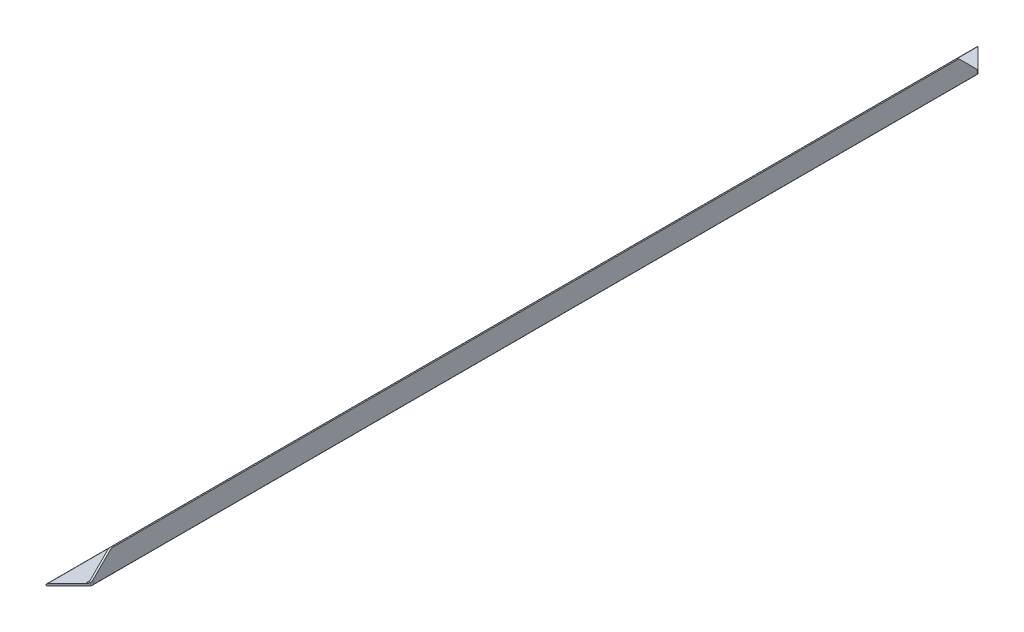
from build123d import *

# Parameters (mm, degrees)
BOSS_EXTRUDE1_DEPTH = 706
FILLET1_R           = 1.5
CUT_EXTRUDE1_DEPTH  = 708.733000502
CUT_EXTRUDE2_DEPTH  = 10
FILLET2_R           = 4
FILLET3_R           = 4
FILLET4_R           = 4
FILLET5_R           = 4
CUT_EXTRUDE3_DEPTH  = 10


with BuildPart() as part:
    # Sketch1 → Boss-Extrude1 (new, symmetric)
    with BuildSketch(Plane.XY):
        with BuildLine():
            Line((-1, 0), (-35, 0))
            Line((-35, 0), (-35, 3))
            Line((-35, 3), (-6, 3))
            ThreePointArc((-6, 3), (-3.878679656, 3.878679656), (-3, 6))
            Line((-3, 6), (-3, 35))
            Line((-3, 35), (0, 35))
            Line((0, 35), (0, 1))
            ThreePointArc((0, 1), (-0.292893219, 0.292893219), (-1, 0))
        make_face()
    extrude(amount=BOSS_EXTRUDE1_DEPTH, both=True)

    # Fillet1
    fillet1_edges = [part.edges().sort_by_distance(p)[0] for p in [
        (-35, 3, 0),
        (-3, 35, 0),
    ]]
    fillet(fillet1_edges, radius=FILLET1_R)

    # Sketch2 → Cut-Extrude1 (cut, through all)
    with BuildSketch(Plane.XZ):
        Polygon((-35, -706), (0, -671), (0, -706), align=None)
    cut_extrude1 = extrude(amount=-CUT_EXTRUDE1_DEPTH, mode=Mode.SUBTRACT)

    # Sketch3 → Cut-Extrude2 (cut)
    with BuildSketch(Plane(origin=(0, 0, 0), x_dir=(0, 0, -1), z_dir=(1, 0, 0))):
        Polygon((642, 35), (674, 3), (706, 3), (674, 35), align=None)
    cut_extrude2 = extrude(amount=-CUT_EXTRUDE2_DEPTH, mode=Mode.SUBTRACT)

    # Mirror1: Cut-Extrude1, Cut-Extrude2 across plane
    add(cut_extrude1.mirror(Plane.XY), mode=Mode.SUBTRACT)
    add(cut_extrude2.mirror(Plane.XY), mode=Mode.SUBTRACT)

    # Fillet2
    # the kernel refuses this fillet: 4 mm, written as the material it takes off along each edge
    with BuildSketch(Plane(origin=(4.142135624, 35, -642), x_dir=(0, 0, 1), z_dir=(-1, 0, 0))) as fillet2_piece_1:
        with BuildLine():
            CenterArc((FILLET2_R * 0.414213562373, -FILLET2_R), FILLET2_R, 90, 45)
            Line((-FILLET2_R * 0.292893218813, -FILLET2_R * 0.292893218813), (0, 0))
            Line((0, 0), (FILLET2_R * 0.414213562373, 0))
        make_face()
    extrude(amount=9.784271247, mode=Mode.SUBTRACT)

    # Fillet3
    # the kernel refuses this fillet: 4 mm, written as the material it takes off along each edge
    with BuildSketch(Plane(origin=(0, -3.142135624, -671), x_dir=(-0.707106781186569, 0, -0.707106781186526), z_dir=(0, 1, 0))) as fillet3_piece_1:
        with BuildLine():
            CenterArc((FILLET3_R * 0.414213562373, FILLET3_R), FILLET3_R, 225, 45)
            Line((-FILLET3_R * 0.292893218813, FILLET3_R * 0.292893218813), (0, 0))
            Line((0, 0), (FILLET3_R * 0.414213562373, 0))
        make_face()
    extrude(amount=13.284271247, mode=Mode.SUBTRACT)

    # Fillet4
    # the kernel refuses this fillet: 4 mm, written as the material it takes off along each edge
    with BuildSketch(Plane(origin=(0, -3.142135624, 671), x_dir=(-0.707106781186569, 0, 0.707106781186526), z_dir=(0, 1, 0))) as fillet4_piece_1:
        with BuildLine():
            CenterArc((FILLET4_R * 0.414213562373, -FILLET4_R), FILLET4_R, 90, 45)
            Line((-FILLET4_R * 0.292893218813, -FILLET4_R * 0.292893218813), (0, 0))
            Line((0, 0), (FILLET4_R * 0.414213562373, 0))
        make_face()
    extrude(amount=13.284271247, mode=Mode.SUBTRACT)

    # Fillet5
    # the kernel refuses this fillet: 4 mm, written as the material it takes off along each edge
    with BuildSketch(Plane(origin=(4.142135624, 35, 642), x_dir=(0, -0.7071067811865432, 0.7071067811865518), z_dir=(-1, 0, 0))) as fillet5_piece_1:
        with BuildLine():
            CenterArc((FILLET5_R * 0.414213562373, -FILLET5_R), FILLET5_R, 90, 45)
            Line((-FILLET5_R * 0.292893218813, -FILLET5_R * 0.292893218813), (0, 0))
            Line((0, 0), (FILLET5_R * 0.414213562373, 0))
        make_face()
    extrude(amount=9.784271247, mode=Mode.SUBTRACT)

    # Sketch4 → Cut-Extrude3 (cut)
    with BuildSketch(Plane.ZY.offset(35)):
        Polygon((711.147996861, -1.5), (711.147996861, 1.5), (706, 1.5), (706, 1), (706, 0), (705, 0), (700.876909591, 0), (700.876909591, -1.5), align=None)
        with BuildLine():
            Line((706, 0), (706, 1))
            ThreePointArc((706, 1), (705.707106781, 0.292893219), (705, 0))
            Line((705, 0), (706, 0))
        make_face()
    cut_extrude3 = extrude(amount=-CUT_EXTRUDE3_DEPTH, mode=Mode.SUBTRACT)

    # Mirror2: Cut-Extrude3 across plane
    add(cut_extrude3.mirror(Plane.XY), mode=Mode.SUBTRACT)


solid = part.part
